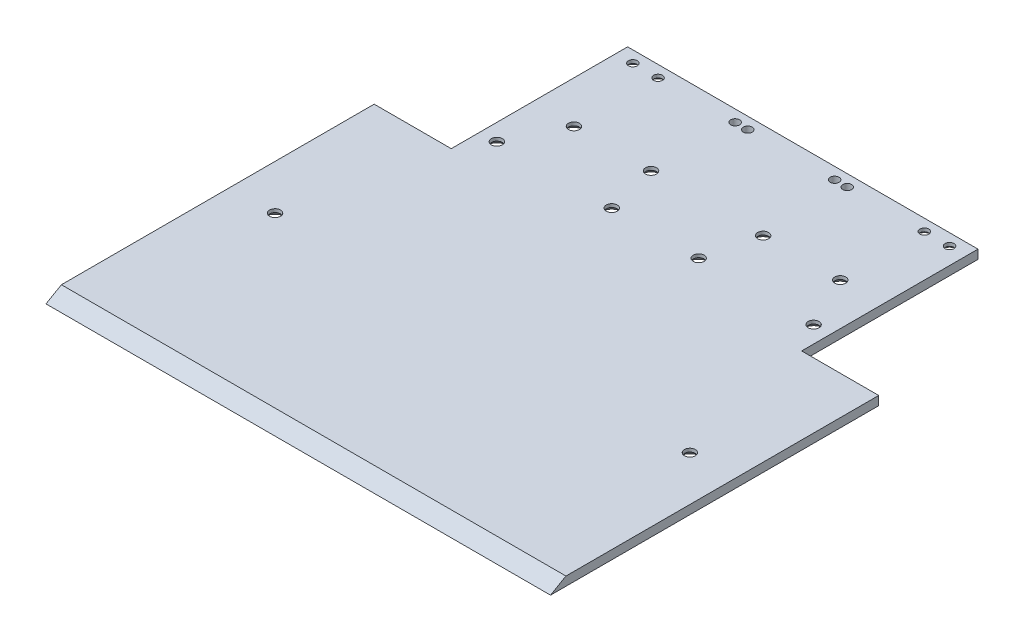
from build123d import *

# Parameters (mm, degrees)
SALIENTE_EXTRUIR1_DEPTH                      = 3.17
CORTAR_EXTRUIR1_REACH                        = 203.271
CORTAR_EXTRUIR2_REACH                        = 129.319
CROQUIS3_R                                   = 1.585
CORTAR_EXTRUIR3_REACH                        = 129.319
CROQUIS4_R                                   = 1.585
CORTAR_EXTRUIR4_REACH                        = 129.319
CROQUIS6_R                                   = 1.585
CORTAR_EXTRUIR5_REACH                        = 129.319
CROQUIS7_R                                   = 1.585
CROQUIS15_R                                  = 4
CORTAR_EXTRUIR6_DEPTH                        = 2
CORTAR_EXTRUIR6_DRAFT                        = -50.5
CORTAR_EXTRUIR6_PROFILE_2_DEPTH              = 2
CORTAR_EXTRUIR6_PROFILE_2_DRAFT              = -50.5
CORTAR_EXTRUIR6_PROFILE_3_DEPTH              = 2
CORTAR_EXTRUIR6_PROFILE_3_DRAFT              = -50.5
CORTAR_EXTRUIR6_PROFILE_4_DEPTH              = 2
CORTAR_EXTRUIR6_PROFILE_4_DRAFT              = -50.5
CORTAR_EXTRUIR6_PROFILE_5_DEPTH              = 2
CORTAR_EXTRUIR6_PROFILE_5_DRAFT              = -50.5
CORTAR_EXTRUIR6_PROFILE_6_DEPTH              = 2
CORTAR_EXTRUIR6_PROFILE_6_DRAFT              = -50.5
CORTAR_EXTRUIR6_PROFILE_7_DEPTH              = 2
CORTAR_EXTRUIR6_PROFILE_7_DRAFT              = -50.5
SIMETR_A3_COPY_1_SKETCH_R                    = 4
SIMETR_A3_COPY_1_DEPTH                       = 2
SIMETR_A3_COPY_1_DRAFT                       = -50.5
SIMETR_A3_COPY_2_SKETCH_R                    = 4
SIMETR_A3_COPY_2_DEPTH                       = 2
SIMETR_A3_COPY_2_DRAFT                       = -50.5
SIMETR_A3_COPY_3_SKETCH_R                    = 4
SIMETR_A3_COPY_3_DEPTH                       = 2
SIMETR_A3_COPY_3_DRAFT                       = -50.5
SIMETR_A3_COPY_4_SKETCH_R                    = 4
SIMETR_A3_COPY_4_DEPTH                       = 2
SIMETR_A3_COPY_4_DRAFT                       = -50.5
SIMETR_A3_COPY_5_SKETCH_R                    = 4
SIMETR_A3_COPY_5_DEPTH                       = 2
SIMETR_A3_COPY_5_DRAFT                       = -50.5
SIMETR_A3_COPY_6_SKETCH_R                    = 4
SIMETR_A3_COPY_6_DEPTH                       = 2
SIMETR_A3_COPY_6_DRAFT                       = -50.5
SIMETR_A3_COPY_7_SKETCH_R                    = 4
SIMETR_A3_COPY_7_DEPTH                       = 2
SIMETR_A3_COPY_7_DRAFT                       = -50.5
SIMETR_A3_COPY_8_SKETCH_R                    = 4
SIMETR_A3_COPY_8_DEPTH                       = 2
SIMETR_A3_COPY_8_DRAFT                       = -50.5
SIMETR_A3_COPY_9_SKETCH_R                    = 4
SIMETR_A3_COPY_9_DEPTH                       = 2
SIMETR_A3_COPY_9_DRAFT                       = -50.5
SIMETR_A3_COPY_10_SKETCH_R                   = 4
SIMETR_A3_COPY_10_DEPTH                      = 2
SIMETR_A3_COPY_10_DRAFT                      = -50.5
SIMETR_A3_COPY_11_SKETCH_R                   = 4
SIMETR_A3_COPY_11_DEPTH                      = 2
SIMETR_A3_COPY_11_DRAFT                      = -50.5
SIMETR_A3_COPY_12_SKETCH_R                   = 4
SIMETR_A3_COPY_12_DEPTH                      = 2
SIMETR_A3_COPY_12_DRAFT                      = -50.5
SIMETR_A3_COPY_13_SKETCH_R                   = 4
SIMETR_A3_COPY_13_DEPTH                      = 2
SIMETR_A3_COPY_13_DRAFT                      = -50.5
AVELLANADO_PARA_TORNILLO_CON_CABEZA_2_COUNT  = 2
AVELLANADO_PARA_TORNILLO_CON_CABEZA_2_PITCH  = 64.066814151
AVELLANADO_PARA_TORNILLO_CON_CABEZA_3_COUNT  = 2
AVELLANADO_PARA_TORNILLO_CON_CABEZA_3_PITCH  = 84.398647009
AVELLANADO_PARA_TORNILLO_CON_CABEZA_4_COUNT  = 2
AVELLANADO_PARA_TORNILLO_CON_CABEZA_4_PITCH  = 96.627540675
AVELLANADO_PARA_TORNILLO_CON_CABEZA_5_COUNT  = 2
AVELLANADO_PARA_TORNILLO_CON_CABEZA_5_PITCH  = 84.973858777
AVELLANADO_PARA_TORNILLO_CON_CABEZA_6_COUNT  = 2
AVELLANADO_PARA_TORNILLO_CON_CABEZA_6_PITCH  = 108.667183066
AVELLANADO_PARA_TORNILLO_CON_CABEZA_7_COUNT  = 2
AVELLANADO_PARA_TORNILLO_CON_CABEZA_7_PITCH  = 123.518750062
AVELLANADO_PARA_TORNILLO_CON_CABEZA_8_COUNT  = 2
AVELLANADO_PARA_TORNILLO_CON_CABEZA_8_PITCH  = 145.544259993
AVELLANADO_PARA_TORNILLO_CON_CABEZA_9_COUNT  = 2
AVELLANADO_PARA_TORNILLO_CON_CABEZA_9_PITCH  = 144.321019521
AVELLANADO_PARA_TORNILLO_CON_CABEZA_10_COUNT = 2
AVELLANADO_PARA_TORNILLO_CON_CABEZA_10_PITCH = 148


with BuildPart() as part:
    # Croquis1 → Saliente-Extruir1 (new body)
    with BuildSketch(Plane(origin=(0, 0, 0), x_dir=(1, 0, 0), z_dir=(0, 1, 0))):
        Polygon((-62.5, 90), (-62.5, 27.08), (-90, 27.08), (-90, -90), (90, -90), (90, 27.08), (62.5, 27.08), (62.5, 90), align=None)
    extrude(amount=SALIENTE_EXTRUIR1_DEPTH)

    # Croquis2 → Cortar-Extruir1 (cut, up to next)
    with BuildSketch(Plane.ZY.offset(90), mode=Mode.PRIVATE) as cortar_extruir1_sk1:
        Polygon((90, 0), (84.50939894, 3.17), (90, 3.17), align=None)
    cortar_extruir1_tool1 = extrude(cortar_extruir1_sk1.sketch, amount=-CORTAR_EXTRUIR1_REACH, mode=Mode.PRIVATE) & part.part
    add(cortar_extruir1_tool1.solids().sort_by_distance((-90, 2.113333, 88.1698))[0], mode=Mode.SUBTRACT)

    # Croquis3 → Cortar-Extruir2 (cut, up to next)
    with BuildSketch(Plane(origin=(0, 3.17, 0), x_dir=(1, 0, 0), z_dir=(0, 1, 0)), mode=Mode.PRIVATE) as cortar_extruir2_sk1:
        with Locations((74, -24.279339937)):
            Circle(CROQUIS3_R)
    cortar_extruir2_tool1 = extrude(cortar_extruir2_sk1.sketch, amount=-CORTAR_EXTRUIR2_REACH, mode=Mode.PRIVATE) & part.part
    cortar_extruir2 = cortar_extruir2_tool1.solids().sort_by_distance((74, 3.17, 24.27934))[0]
    add(cortar_extruir2, mode=Mode.SUBTRACT)

    # Simetría1: Cortar-Extruir2 across plane
    add(cortar_extruir2.mirror(Plane(origin=(0, 0, 0), x_dir=(0, 0, 1), z_dir=(1, 0, 0))), mode=Mode.SUBTRACT)

    # Croquis4 → Cortar-Extruir3 (cut, up to next)
    with BuildSketch(Plane(origin=(0, 3.17, 0), x_dir=(1, 0, 0), z_dir=(0, 1, 0)), mode=Mode.PRIVATE) as cortar_extruir3_sk1:
        with Locations((-56.5, 37.351063887)):
            Circle(CROQUIS4_R)
    cortar_extruir3_tool1 = extrude(cortar_extruir3_sk1.sketch, amount=-CORTAR_EXTRUIR3_REACH, mode=Mode.PRIVATE) & part.part
    # Croquis4 → Cortar-Extruir3 (cut, up to next)
    with BuildSketch(Plane(origin=(0, 3.17, 0), x_dir=(1, 0, 0), z_dir=(0, 1, 0)), mode=Mode.PRIVATE) as cortar_extruir3_sk2:
        with Locations((-15.5, 37.351063887)):
            Circle(CROQUIS4_R)
    cortar_extruir3_tool2 = extrude(cortar_extruir3_sk2.sketch, amount=-CORTAR_EXTRUIR3_REACH, mode=Mode.PRIVATE) & part.part
    # Croquis4 → Cortar-Extruir3 (cut, up to next)
    with BuildSketch(Plane(origin=(0, 3.17, 0), x_dir=(1, 0, 0), z_dir=(0, 1, 0)), mode=Mode.PRIVATE) as cortar_extruir3_sk3:
        with Locations((-15.5, 85.851063887)):
            Circle(CROQUIS4_R)
    cortar_extruir3_tool3 = extrude(cortar_extruir3_sk3.sketch, amount=-CORTAR_EXTRUIR3_REACH, mode=Mode.PRIVATE) & part.part
    # Croquis4 → Cortar-Extruir3 (cut, up to next)
    with BuildSketch(Plane(origin=(0, 3.17, 0), x_dir=(1, 0, 0), z_dir=(0, 1, 0)), mode=Mode.PRIVATE) as cortar_extruir3_sk4:
        with Locations((-56.5, 85.851063887)):
            Circle(CROQUIS4_R)
    cortar_extruir3_tool4 = extrude(cortar_extruir3_sk4.sketch, amount=-CORTAR_EXTRUIR3_REACH, mode=Mode.PRIVATE) & part.part
    add(cortar_extruir3_tool1.solids().sort_by_distance((-56.5, 3.17, -37.351064))[0], mode=Mode.SUBTRACT)
    add(cortar_extruir3_tool2.solids().sort_by_distance((-15.5, 3.17, -37.351064))[0], mode=Mode.SUBTRACT)
    add(cortar_extruir3_tool3.solids().sort_by_distance((-15.5, 3.17, -85.851064))[0], mode=Mode.SUBTRACT)
    add(cortar_extruir3_tool4.solids().sort_by_distance((-56.5, 3.17, -85.851064))[0], mode=Mode.SUBTRACT)

    # Croquis6 → Cortar-Extruir4 (cut, up to next)
    with BuildSketch(Plane(origin=(0, 3.17, 0), x_dir=(1, 0, 0), z_dir=(0, 1, 0)), mode=Mode.PRIVATE) as cortar_extruir4_sk1:
        with Locations((56.5, 85.851063887)):
            Circle(CROQUIS6_R)
    cortar_extruir4_tool1 = extrude(cortar_extruir4_sk1.sketch, amount=-CORTAR_EXTRUIR4_REACH, mode=Mode.PRIVATE) & part.part
    # Croquis6 → Cortar-Extruir4 (cut, up to next)
    with BuildSketch(Plane(origin=(0, 3.17, 0), x_dir=(1, 0, 0), z_dir=(0, 1, 0)), mode=Mode.PRIVATE) as cortar_extruir4_sk2:
        with Locations((15.5, 85.851063887)):
            Circle(CROQUIS6_R)
    cortar_extruir4_tool2 = extrude(cortar_extruir4_sk2.sketch, amount=-CORTAR_EXTRUIR4_REACH, mode=Mode.PRIVATE) & part.part
    # Croquis6 → Cortar-Extruir4 (cut, up to next)
    with BuildSketch(Plane(origin=(0, 3.17, 0), x_dir=(1, 0, 0), z_dir=(0, 1, 0)), mode=Mode.PRIVATE) as cortar_extruir4_sk3:
        with Locations((15.5, 37.351063887)):
            Circle(CROQUIS6_R)
    cortar_extruir4_tool3 = extrude(cortar_extruir4_sk3.sketch, amount=-CORTAR_EXTRUIR4_REACH, mode=Mode.PRIVATE) & part.part
    # Croquis6 → Cortar-Extruir4 (cut, up to next)
    with BuildSketch(Plane(origin=(0, 3.17, 0), x_dir=(1, 0, 0), z_dir=(0, 1, 0)), mode=Mode.PRIVATE) as cortar_extruir4_sk4:
        with Locations((56.5, 37.351063887)):
            Circle(CROQUIS6_R)
    cortar_extruir4_tool4 = extrude(cortar_extruir4_sk4.sketch, amount=-CORTAR_EXTRUIR4_REACH, mode=Mode.PRIVATE) & part.part
    add(cortar_extruir4_tool1.solids().sort_by_distance((56.5, 3.17, -85.851064))[0], mode=Mode.SUBTRACT)
    add(cortar_extruir4_tool2.solids().sort_by_distance((15.5, 3.17, -85.851064))[0], mode=Mode.SUBTRACT)
    add(cortar_extruir4_tool3.solids().sort_by_distance((15.5, 3.17, -37.351064))[0], mode=Mode.SUBTRACT)
    add(cortar_extruir4_tool4.solids().sort_by_distance((56.5, 3.17, -37.351064))[0], mode=Mode.SUBTRACT)

    # Croquis7 → Cortar-Extruir5 (cut, up to next)
    with BuildSketch(Plane(origin=(0, 3.17, 0), x_dir=(1, 0, 0), z_dir=(0, 1, 0)), mode=Mode.PRIVATE) as cortar_extruir5_sk1:
        with Locations((-20, 85.851063887)):
            Circle(CROQUIS7_R)
    cortar_extruir5_tool1 = extrude(cortar_extruir5_sk1.sketch, amount=-CORTAR_EXTRUIR5_REACH, mode=Mode.PRIVATE) & part.part
    # Croquis7 → Cortar-Extruir5 (cut, up to next)
    with BuildSketch(Plane(origin=(0, 3.17, 0), x_dir=(1, 0, 0), z_dir=(0, 1, 0)), mode=Mode.PRIVATE) as cortar_extruir5_sk2:
        with Locations((-47.5, 85.851063887)):
            Circle(CROQUIS7_R)
    cortar_extruir5_tool2 = extrude(cortar_extruir5_sk2.sketch, amount=-CORTAR_EXTRUIR5_REACH, mode=Mode.PRIVATE) & part.part
    # Croquis7 → Cortar-Extruir5 (cut, up to next)
    with BuildSketch(Plane(origin=(0, 3.17, 0), x_dir=(1, 0, 0), z_dir=(0, 1, 0)), mode=Mode.PRIVATE) as cortar_extruir5_sk3:
        with Locations((-47.5, 55.851063887)):
            Circle(CROQUIS7_R)
    cortar_extruir5_tool3 = extrude(cortar_extruir5_sk3.sketch, amount=-CORTAR_EXTRUIR5_REACH, mode=Mode.PRIVATE) & part.part
    # Croquis7 → Cortar-Extruir5 (cut, up to next)
    with BuildSketch(Plane(origin=(0, 3.17, 0), x_dir=(1, 0, 0), z_dir=(0, 1, 0)), mode=Mode.PRIVATE) as cortar_extruir5_sk4:
        with Locations((-20, 55.851063887)):
            Circle(CROQUIS7_R)
    cortar_extruir5_tool4 = extrude(cortar_extruir5_sk4.sketch, amount=-CORTAR_EXTRUIR5_REACH, mode=Mode.PRIVATE) & part.part
    cortar_extruir5_1 = cortar_extruir5_tool1.solids().sort_by_distance((-20, 3.17, -85.851064))[0]
    add(cortar_extruir5_1, mode=Mode.SUBTRACT)
    cortar_extruir5_2 = cortar_extruir5_tool2.solids().sort_by_distance((-47.5, 3.17, -85.851064))[0]
    add(cortar_extruir5_2, mode=Mode.SUBTRACT)
    cortar_extruir5_3 = cortar_extruir5_tool3.solids().sort_by_distance((-47.5, 3.17, -55.851064))[0]
    add(cortar_extruir5_3, mode=Mode.SUBTRACT)
    cortar_extruir5_4 = cortar_extruir5_tool4.solids().sort_by_distance((-20, 3.17, -55.851064))[0]
    add(cortar_extruir5_4, mode=Mode.SUBTRACT)
    cortar_extruir5 = cortar_extruir5_1 + cortar_extruir5_2 + cortar_extruir5_3 + cortar_extruir5_4  # Cortar-Extruir5 as one shape, for the pattern or mirror that repeats it

    # Simetría2: Cortar-Extruir5 across plane
    add(cortar_extruir5.mirror(Plane(origin=(0, 0, 0), x_dir=(0, 0, 1), z_dir=(1, 0, 0))), mode=Mode.SUBTRACT)


with BuildPart() as cortar_extruir6_tool:
    # Croquis15 → Cortar-Extruir6 (with draft: the straight prism first)
    with BuildSketch(Plane(origin=(0, 0, 0), x_dir=(-1, 0, 0), z_dir=(0, -1, 0))):
        with Locations((20, 55.851063887)):
            Circle(CROQUIS15_R)
    extrude(amount=-CORTAR_EXTRUIR6_DEPTH)
    # Cortar-Extruir6: the draft: its side faces are tilted about the plane it starts from
    cortar_extruir6_sides = [cortar_extruir6_tool.faces().sort_by_distance(p)[0] for p in [
        (-16, 1, -55.851063887),
    ]]
    draft(cortar_extruir6_sides, Plane(origin=(0, 0, 0), x_dir=(-1, 0, 0), z_dir=(0, -1, 0)), CORTAR_EXTRUIR6_DRAFT)


with BuildPart() as part_1:
    add(part.part)

    # Cortar-Extruir6: cut by cortar_extruir6_tool
    add(cortar_extruir6_tool.part, mode=Mode.SUBTRACT)


with BuildPart() as cortar_extruir6_profile_2_tool:
    # Croquis15 → Cortar-Extruir6 profile 2 (with draft: the straight prism first)
    with BuildSketch(Plane(origin=(0, 0, 0), x_dir=(-1, 0, 0), z_dir=(0, -1, 0))):
        with Locations((15.5, 37.351063887)):
            Circle(CROQUIS15_R)
    extrude(amount=-CORTAR_EXTRUIR6_PROFILE_2_DEPTH)
    # Cortar-Extruir6 profile 2: the draft: its side faces are tilted about the plane it starts from
    cortar_extruir6_profile_2_sides = [cortar_extruir6_profile_2_tool.faces().sort_by_distance(p)[0] for p in [
        (-11.5, 1, -37.351063887),
    ]]
    draft(cortar_extruir6_profile_2_sides, Plane(origin=(0, 0, 0), x_dir=(-1, 0, 0), z_dir=(0, -1, 0)), CORTAR_EXTRUIR6_PROFILE_2_DRAFT)


with BuildPart() as part_2:
    add(part_1.part)

    # Cortar-Extruir6 profile 2: cut by cortar_extruir6_profile_2_tool
    add(cortar_extruir6_profile_2_tool.part, mode=Mode.SUBTRACT)


with BuildPart() as cortar_extruir6_profile_3_tool:
    # Croquis15 → Cortar-Extruir6 profile 3 (with draft: the straight prism first)
    with BuildSketch(Plane(origin=(0, 0, 0), x_dir=(-1, 0, 0), z_dir=(0, -1, 0))):
        with Locations((56.5, 37.351063887)):
            Circle(CROQUIS15_R)
    extrude(amount=-CORTAR_EXTRUIR6_PROFILE_3_DEPTH)
    # Cortar-Extruir6 profile 3: the draft: its side faces are tilted about the plane it starts from
    cortar_extruir6_profile_3_sides = [cortar_extruir6_profile_3_tool.faces().sort_by_distance(p)[0] for p in [
        (-52.5, 1, -37.351063887),
    ]]
    draft(cortar_extruir6_profile_3_sides, Plane(origin=(0, 0, 0), x_dir=(-1, 0, 0), z_dir=(0, -1, 0)), CORTAR_EXTRUIR6_PROFILE_3_DRAFT)


with BuildPart() as part_3:
    add(part_2.part)

    # Cortar-Extruir6 profile 3: cut by cortar_extruir6_profile_3_tool
    add(cortar_extruir6_profile_3_tool.part, mode=Mode.SUBTRACT)


with BuildPart() as cortar_extruir6_profile_4_tool:
    # Croquis15 → Cortar-Extruir6 profile 4 (with draft: the straight prism first)
    with BuildSketch(Plane(origin=(0, 0, 0), x_dir=(-1, 0, 0), z_dir=(0, -1, 0))):
        with Locations((47.5, 55.851063887)):
            Circle(CROQUIS15_R)
    extrude(amount=-CORTAR_EXTRUIR6_PROFILE_4_DEPTH)
    # Cortar-Extruir6 profile 4: the draft: its side faces are tilted about the plane it starts from
    cortar_extruir6_profile_4_sides = [cortar_extruir6_profile_4_tool.faces().sort_by_distance(p)[0] for p in [
        (-43.5, 1, -55.851063887),
    ]]
    draft(cortar_extruir6_profile_4_sides, Plane(origin=(0, 0, 0), x_dir=(-1, 0, 0), z_dir=(0, -1, 0)), CORTAR_EXTRUIR6_PROFILE_4_DRAFT)


with BuildPart() as part_4:
    add(part_3.part)

    # Cortar-Extruir6 profile 4: cut by cortar_extruir6_profile_4_tool
    add(cortar_extruir6_profile_4_tool.part, mode=Mode.SUBTRACT)


with BuildPart() as cortar_extruir6_profile_5_tool:
    # Croquis15 → Cortar-Extruir6 profile 5 (with draft: the straight prism first)
    with BuildSketch(Plane(origin=(0, 0, 0), x_dir=(-1, 0, 0), z_dir=(0, -1, 0))):
        with Locations((56.5, 85.851063887)):
            Circle(CROQUIS15_R)
    extrude(amount=-CORTAR_EXTRUIR6_PROFILE_5_DEPTH)
    # Cortar-Extruir6 profile 5: the draft: its side faces are tilted about the plane it starts from
    cortar_extruir6_profile_5_sides = [cortar_extruir6_profile_5_tool.faces().sort_by_distance(p)[0] for p in [
        (-52.5, 1, -85.851063887),
    ]]
    draft(cortar_extruir6_profile_5_sides, Plane(origin=(0, 0, 0), x_dir=(-1, 0, 0), z_dir=(0, -1, 0)), CORTAR_EXTRUIR6_PROFILE_5_DRAFT)


with BuildPart() as part_5:
    add(part_4.part)

    # Cortar-Extruir6 profile 5: cut by cortar_extruir6_profile_5_tool
    add(cortar_extruir6_profile_5_tool.part, mode=Mode.SUBTRACT)


with BuildPart() as cortar_extruir6_profile_6_tool:
    # Croquis15 → Cortar-Extruir6 profile 6 (with draft: the straight prism first)
    with BuildSketch(Plane(origin=(0, 0, 0), x_dir=(-1, 0, 0), z_dir=(0, -1, 0))):
        with Locations((47.5, 85.851063887)):
            Circle(CROQUIS15_R)
    extrude(amount=-CORTAR_EXTRUIR6_PROFILE_6_DEPTH)
    # Cortar-Extruir6 profile 6: the draft: its side faces are tilted about the plane it starts from
    cortar_extruir6_profile_6_sides = [cortar_extruir6_profile_6_tool.faces().sort_by_distance(p)[0] for p in [
        (-43.5, 1, -85.851063887),
    ]]
    draft(cortar_extruir6_profile_6_sides, Plane(origin=(0, 0, 0), x_dir=(-1, 0, 0), z_dir=(0, -1, 0)), CORTAR_EXTRUIR6_PROFILE_6_DRAFT)


with BuildPart() as part_6:
    add(part_5.part)

    # Cortar-Extruir6 profile 6: cut by cortar_extruir6_profile_6_tool
    add(cortar_extruir6_profile_6_tool.part, mode=Mode.SUBTRACT)


with BuildPart() as cortar_extruir6_profile_7_tool:
    # Croquis15 → Cortar-Extruir6 profile 7 (with draft: the straight prism first)
    with BuildSketch(Plane(origin=(0, 0, 0), x_dir=(-1, 0, 0), z_dir=(0, -1, 0))):
        with Locations((74, -24.279339937)):
            Circle(CROQUIS15_R)
    extrude(amount=-CORTAR_EXTRUIR6_PROFILE_7_DEPTH)
    # Cortar-Extruir6 profile 7: the draft: its side faces are tilted about the plane it starts from
    cortar_extruir6_profile_7_sides = [cortar_extruir6_profile_7_tool.faces().sort_by_distance(p)[0] for p in [
        (-70, 1, 24.279339937),
    ]]
    draft(cortar_extruir6_profile_7_sides, Plane(origin=(0, 0, 0), x_dir=(-1, 0, 0), z_dir=(0, -1, 0)), CORTAR_EXTRUIR6_PROFILE_7_DRAFT)


with BuildPart() as part_7:
    add(part_6.part)

    # Cortar-Extruir6 profile 7: cut by cortar_extruir6_profile_7_tool
    add(cortar_extruir6_profile_7_tool.part, mode=Mode.SUBTRACT)


with BuildPart() as simetr_a3_copy_1_tool:
    # Simetría3 copy 1 sketch → Simetría3 copy 1 (with draft: the straight prism first)
    with BuildSketch(Plane.XZ):
        with Locations((20, -55.851063887)):
            Circle(SIMETR_A3_COPY_1_SKETCH_R)
    extrude(amount=-SIMETR_A3_COPY_1_DEPTH)
    # Simetría3 copy 1: the draft: its side faces are tilted about the plane it starts from
    simetr_a3_copy_1_sides = [simetr_a3_copy_1_tool.faces().sort_by_distance(p)[0] for p in [
        (16, 1, -55.851063887),
    ]]
    draft(simetr_a3_copy_1_sides, Plane.XZ, SIMETR_A3_COPY_1_DRAFT)


with BuildPart() as part_8:
    add(part_7.part)

    # Simetría3 copy 1: cut by simetr_a3_copy_1_tool
    add(simetr_a3_copy_1_tool.part, mode=Mode.SUBTRACT)


with BuildPart() as simetr_a3_copy_2_tool:
    # Simetría3 copy 2 sketch → Simetría3 copy 2 (with draft: the straight prism first)
    with BuildSketch(Plane.XZ):
        with Locations((15.5, -37.351063887)):
            Circle(SIMETR_A3_COPY_2_SKETCH_R)
    extrude(amount=-SIMETR_A3_COPY_2_DEPTH)
    # Simetría3 copy 2: the draft: its side faces are tilted about the plane it starts from
    simetr_a3_copy_2_sides = [simetr_a3_copy_2_tool.faces().sort_by_distance(p)[0] for p in [
        (11.5, 1, -37.351063887),
    ]]
    draft(simetr_a3_copy_2_sides, Plane.XZ, SIMETR_A3_COPY_2_DRAFT)


with BuildPart() as part_9:
    add(part_8.part)

    # Simetría3 copy 2: cut by simetr_a3_copy_2_tool
    add(simetr_a3_copy_2_tool.part, mode=Mode.SUBTRACT)


with BuildPart() as simetr_a3_copy_3_tool:
    # Simetría3 copy 3 sketch → Simetría3 copy 3 (with draft: the straight prism first)
    with BuildSketch(Plane.XZ):
        with Locations((56.5, -37.351063887)):
            Circle(SIMETR_A3_COPY_3_SKETCH_R)
    extrude(amount=-SIMETR_A3_COPY_3_DEPTH)
    # Simetría3 copy 3: the draft: its side faces are tilted about the plane it starts from
    simetr_a3_copy_3_sides = [simetr_a3_copy_3_tool.faces().sort_by_distance(p)[0] for p in [
        (52.5, 1, -37.351063887),
    ]]
    draft(simetr_a3_copy_3_sides, Plane.XZ, SIMETR_A3_COPY_3_DRAFT)


with BuildPart() as part_10:
    add(part_9.part)

    # Simetría3 copy 3: cut by simetr_a3_copy_3_tool
    add(simetr_a3_copy_3_tool.part, mode=Mode.SUBTRACT)


with BuildPart() as simetr_a3_copy_4_tool:
    # Simetría3 copy 4 sketch → Simetría3 copy 4 (with draft: the straight prism first)
    with BuildSketch(Plane.XZ):
        with Locations((47.5, -55.851063887)):
            Circle(SIMETR_A3_COPY_4_SKETCH_R)
    extrude(amount=-SIMETR_A3_COPY_4_DEPTH)
    # Simetría3 copy 4: the draft: its side faces are tilted about the plane it starts from
    simetr_a3_copy_4_sides = [simetr_a3_copy_4_tool.faces().sort_by_distance(p)[0] for p in [
        (43.5, 1, -55.851063887),
    ]]
    draft(simetr_a3_copy_4_sides, Plane.XZ, SIMETR_A3_COPY_4_DRAFT)


with BuildPart() as part_11:
    add(part_10.part)

    # Simetría3 copy 4: cut by simetr_a3_copy_4_tool
    add(simetr_a3_copy_4_tool.part, mode=Mode.SUBTRACT)


with BuildPart() as simetr_a3_copy_5_tool:
    # Simetría3 copy 5 sketch → Simetría3 copy 5 (with draft: the straight prism first)
    with BuildSketch(Plane.XZ):
        with Locations((56.5, -85.851063887)):
            Circle(SIMETR_A3_COPY_5_SKETCH_R)
    extrude(amount=-SIMETR_A3_COPY_5_DEPTH)
    # Simetría3 copy 5: the draft: its side faces are tilted about the plane it starts from
    simetr_a3_copy_5_sides = [simetr_a3_copy_5_tool.faces().sort_by_distance(p)[0] for p in [
        (52.5, 1, -85.851063887),
    ]]
    draft(simetr_a3_copy_5_sides, Plane.XZ, SIMETR_A3_COPY_5_DRAFT)


with BuildPart() as part_12:
    add(part_11.part)

    # Simetría3 copy 5: cut by simetr_a3_copy_5_tool
    add(simetr_a3_copy_5_tool.part, mode=Mode.SUBTRACT)


with BuildPart() as simetr_a3_copy_6_tool:
    # Simetría3 copy 6 sketch → Simetría3 copy 6 (with draft: the straight prism first)
    with BuildSketch(Plane.XZ):
        with Locations((47.5, -85.851063887)):
            Circle(SIMETR_A3_COPY_6_SKETCH_R)
    extrude(amount=-SIMETR_A3_COPY_6_DEPTH)
    # Simetría3 copy 6: the draft: its side faces are tilted about the plane it starts from
    simetr_a3_copy_6_sides = [simetr_a3_copy_6_tool.faces().sort_by_distance(p)[0] for p in [
        (43.5, 1, -85.851063887),
    ]]
    draft(simetr_a3_copy_6_sides, Plane.XZ, SIMETR_A3_COPY_6_DRAFT)


with BuildPart() as part_13:
    add(part_12.part)

    # Simetría3 copy 6: cut by simetr_a3_copy_6_tool
    add(simetr_a3_copy_6_tool.part, mode=Mode.SUBTRACT)


with BuildPart() as simetr_a3_copy_7_tool:
    # Simetría3 copy 7 sketch → Simetría3 copy 7 (with draft: the straight prism first)
    with BuildSketch(Plane.XZ):
        with Locations((74, 24.279339937)):
            Circle(SIMETR_A3_COPY_7_SKETCH_R)
    extrude(amount=-SIMETR_A3_COPY_7_DEPTH)
    # Simetría3 copy 7: the draft: its side faces are tilted about the plane it starts from
    simetr_a3_copy_7_sides = [simetr_a3_copy_7_tool.faces().sort_by_distance(p)[0] for p in [
        (70, 1, 24.279339937),
    ]]
    draft(simetr_a3_copy_7_sides, Plane.XZ, SIMETR_A3_COPY_7_DRAFT)


with BuildPart() as part_14:
    add(part_13.part)

    # Simetría3 copy 7: cut by simetr_a3_copy_7_tool
    add(simetr_a3_copy_7_tool.part, mode=Mode.SUBTRACT)


with BuildPart() as simetr_a3_copy_8_tool:
    # Simetría3 copy 8 sketch → Simetría3 copy 8 (with draft: the straight prism first)
    with BuildSketch(Plane.XZ):
        with Locations((15.5, -37.351063887)):
            Circle(SIMETR_A3_COPY_8_SKETCH_R)
    extrude(amount=-SIMETR_A3_COPY_8_DEPTH)
    # Simetría3 copy 8: the draft: its side faces are tilted about the plane it starts from
    simetr_a3_copy_8_sides = [simetr_a3_copy_8_tool.faces().sort_by_distance(p)[0] for p in [
        (11.5, 1, -37.351063887),
    ]]
    draft(simetr_a3_copy_8_sides, Plane.XZ, SIMETR_A3_COPY_8_DRAFT)


with BuildPart() as part_15:
    add(part_14.part)

    # Simetría3 copy 8: cut by simetr_a3_copy_8_tool
    add(simetr_a3_copy_8_tool.part, mode=Mode.SUBTRACT)


with BuildPart() as simetr_a3_copy_9_tool:
    # Simetría3 copy 9 sketch → Simetría3 copy 9 (with draft: the straight prism first)
    with BuildSketch(Plane.XZ):
        with Locations((56.5, -37.351063887)):
            Circle(SIMETR_A3_COPY_9_SKETCH_R)
    extrude(amount=-SIMETR_A3_COPY_9_DEPTH)
    # Simetría3 copy 9: the draft: its side faces are tilted about the plane it starts from
    simetr_a3_copy_9_sides = [simetr_a3_copy_9_tool.faces().sort_by_distance(p)[0] for p in [
        (52.5, 1, -37.351063887),
    ]]
    draft(simetr_a3_copy_9_sides, Plane.XZ, SIMETR_A3_COPY_9_DRAFT)


with BuildPart() as part_16:
    add(part_15.part)

    # Simetría3 copy 9: cut by simetr_a3_copy_9_tool
    add(simetr_a3_copy_9_tool.part, mode=Mode.SUBTRACT)


with BuildPart() as simetr_a3_copy_10_tool:
    # Simetría3 copy 10 sketch → Simetría3 copy 10 (with draft: the straight prism first)
    with BuildSketch(Plane.XZ):
        with Locations((47.5, -55.851063887)):
            Circle(SIMETR_A3_COPY_10_SKETCH_R)
    extrude(amount=-SIMETR_A3_COPY_10_DEPTH)
    # Simetría3 copy 10: the draft: its side faces are tilted about the plane it starts from
    simetr_a3_copy_10_sides = [simetr_a3_copy_10_tool.faces().sort_by_distance(p)[0] for p in [
        (43.5, 1, -55.851063887),
    ]]
    draft(simetr_a3_copy_10_sides, Plane.XZ, SIMETR_A3_COPY_10_DRAFT)


with BuildPart() as part_17:
    add(part_16.part)

    # Simetría3 copy 10: cut by simetr_a3_copy_10_tool
    add(simetr_a3_copy_10_tool.part, mode=Mode.SUBTRACT)


with BuildPart() as simetr_a3_copy_11_tool:
    # Simetría3 copy 11 sketch → Simetría3 copy 11 (with draft: the straight prism first)
    with BuildSketch(Plane.XZ):
        with Locations((56.5, -85.851063887)):
            Circle(SIMETR_A3_COPY_11_SKETCH_R)
    extrude(amount=-SIMETR_A3_COPY_11_DEPTH)
    # Simetría3 copy 11: the draft: its side faces are tilted about the plane it starts from
    simetr_a3_copy_11_sides = [simetr_a3_copy_11_tool.faces().sort_by_distance(p)[0] for p in [
        (52.5, 1, -85.851063887),
    ]]
    draft(simetr_a3_copy_11_sides, Plane.XZ, SIMETR_A3_COPY_11_DRAFT)


with BuildPart() as part_18:
    add(part_17.part)

    # Simetría3 copy 11: cut by simetr_a3_copy_11_tool
    add(simetr_a3_copy_11_tool.part, mode=Mode.SUBTRACT)


with BuildPart() as simetr_a3_copy_12_tool:
    # Simetría3 copy 12 sketch → Simetría3 copy 12 (with draft: the straight prism first)
    with BuildSketch(Plane.XZ):
        with Locations((47.5, -85.851063887)):
            Circle(SIMETR_A3_COPY_12_SKETCH_R)
    extrude(amount=-SIMETR_A3_COPY_12_DEPTH)
    # Simetría3 copy 12: the draft: its side faces are tilted about the plane it starts from
    simetr_a3_copy_12_sides = [simetr_a3_copy_12_tool.faces().sort_by_distance(p)[0] for p in [
        (43.5, 1, -85.851063887),
    ]]
    draft(simetr_a3_copy_12_sides, Plane.XZ, SIMETR_A3_COPY_12_DRAFT)


with BuildPart() as part_19:
    add(part_18.part)

    # Simetría3 copy 12: cut by simetr_a3_copy_12_tool
    add(simetr_a3_copy_12_tool.part, mode=Mode.SUBTRACT)


with BuildPart() as simetr_a3_copy_13_tool:
    # Simetría3 copy 13 sketch → Simetría3 copy 13 (with draft: the straight prism first)
    with BuildSketch(Plane.XZ):
        with Locations((74, 24.279339937)):
            Circle(SIMETR_A3_COPY_13_SKETCH_R)
    extrude(amount=-SIMETR_A3_COPY_13_DEPTH)
    # Simetría3 copy 13: the draft: its side faces are tilted about the plane it starts from
    simetr_a3_copy_13_sides = [simetr_a3_copy_13_tool.faces().sort_by_distance(p)[0] for p in [
        (70, 1, 24.279339937),
    ]]
    draft(simetr_a3_copy_13_sides, Plane.XZ, SIMETR_A3_COPY_13_DRAFT)


with BuildPart() as part_20:
    add(part_19.part)

    # Simetría3 copy 13: cut by simetr_a3_copy_13_tool
    add(simetr_a3_copy_13_tool.part, mode=Mode.SUBTRACT)

    # Croquis14 → Avellanado para tornillo con cabeza avellanada en cruz de M3.51 (revolve, cut)
    with BuildSketch(Plane(origin=(74, 0, 24.279339937), x_dir=(0, 0, -1), z_dir=(1, 0, 0))):
        Polygon((0, 0), (0, 3.17), (1.95, 3.17), (1.95, 1.979661988), (4, 0), align=None)
    avellanado_para_tornillo_con_cabeza_avel = revolve(axis=Axis((74, -6.35, 24.279339937), (0, 1, 0)), mode=Mode.SUBTRACT)

    # Avellanado para tornillo con cabeza  2: Avellanado para tornillo con cabeza avellanada en cruz de M3.51 ×2
    with Locations(*[Vector(-0.2731523368520776, 0, -0.9619707900306792) * (i * AVELLANADO_PARA_TORNILLO_CON_CABEZA_2_PITCH) for i in range(1, AVELLANADO_PARA_TORNILLO_CON_CABEZA_2_COUNT)]):
        add(avellanado_para_tornillo_con_cabeza_avel, mode=Mode.SUBTRACT)

    # Avellanado para tornillo con cabeza  3: Avellanado para tornillo con cabeza avellanada en cruz de M3.51 ×2
    with Locations(*[Vector(-0.3139860760708997, 0, -0.9494275875671611) * (i * AVELLANADO_PARA_TORNILLO_CON_CABEZA_3_PITCH) for i in range(1, AVELLANADO_PARA_TORNILLO_CON_CABEZA_3_COUNT)]):
        add(avellanado_para_tornillo_con_cabeza_avel, mode=Mode.SUBTRACT)

    # Avellanado para tornillo con cabeza  4: Avellanado para tornillo con cabeza avellanada en cruz de M3.51 ×2
    with Locations(*[Vector(-0.5588468838460248, 0, -0.8292708607057093) * (i * AVELLANADO_PARA_TORNILLO_CON_CABEZA_4_PITCH) for i in range(1, AVELLANADO_PARA_TORNILLO_CON_CABEZA_4_COUNT)]):
        add(avellanado_para_tornillo_con_cabeza_avel, mode=Mode.SUBTRACT)

    # Avellanado para tornillo con cabeza  5: Avellanado para tornillo con cabeza avellanada en cruz de M3.51 ×2
    with Locations(*[Vector(-0.6884470217308595, 0, -0.725286631801462) * (i * AVELLANADO_PARA_TORNILLO_CON_CABEZA_5_PITCH) for i in range(1, AVELLANADO_PARA_TORNILLO_CON_CABEZA_5_COUNT)]):
        add(avellanado_para_tornillo_con_cabeza_avel, mode=Mode.SUBTRACT)

    # Avellanado para tornillo con cabeza  6: Avellanado para tornillo con cabeza avellanada en cruz de M3.51 ×2
    with Locations(*[Vector(-0.8236157179653746, 0, -0.5671482602639107) * (i * AVELLANADO_PARA_TORNILLO_CON_CABEZA_6_PITCH) for i in range(1, AVELLANADO_PARA_TORNILLO_CON_CABEZA_6_COUNT)]):
        add(avellanado_para_tornillo_con_cabeza_avel, mode=Mode.SUBTRACT)

    # Avellanado para tornillo con cabeza  7: Avellanado para tornillo con cabeza avellanada en cruz de M3.51 ×2
    with Locations(*[Vector(-0.7610180636759967, 0, -0.6487306889294174) * (i * AVELLANADO_PARA_TORNILLO_CON_CABEZA_7_PITCH) for i in range(1, AVELLANADO_PARA_TORNILLO_CON_CABEZA_7_COUNT)]):
        add(avellanado_para_tornillo_con_cabeza_avel, mode=Mode.SUBTRACT)

    # Avellanado para tornillo con cabeza  8: Avellanado para tornillo con cabeza avellanada en cruz de M3.51 ×2
    with Locations(*[Vector(-0.8347976073106893, 0, -0.550556949668559) * (i * AVELLANADO_PARA_TORNILLO_CON_CABEZA_8_PITCH) for i in range(1, AVELLANADO_PARA_TORNILLO_CON_CABEZA_8_COUNT)]):
        add(avellanado_para_tornillo_con_cabeza_avel, mode=Mode.SUBTRACT)

    # Avellanado para tornillo con cabeza  9: Avellanado para tornillo con cabeza avellanada en cruz de M3.51 ×2
    with Locations(*[Vector(-0.9042341887102125, 0, -0.42703692108245617) * (i * AVELLANADO_PARA_TORNILLO_CON_CABEZA_9_PITCH) for i in range(1, AVELLANADO_PARA_TORNILLO_CON_CABEZA_9_COUNT)]):
        add(avellanado_para_tornillo_con_cabeza_avel, mode=Mode.SUBTRACT)

    # Avellanado para tornillo con cabeza  10: Avellanado para tornillo con cabeza avellanada en cruz de M3.51 ×2
    with Locations(*[(-i * AVELLANADO_PARA_TORNILLO_CON_CABEZA_10_PITCH, 0, 0) for i in range(1, AVELLANADO_PARA_TORNILLO_CON_CABEZA_10_COUNT)]):
        add(avellanado_para_tornillo_con_cabeza_avel, mode=Mode.SUBTRACT)


solid = part_20.part
